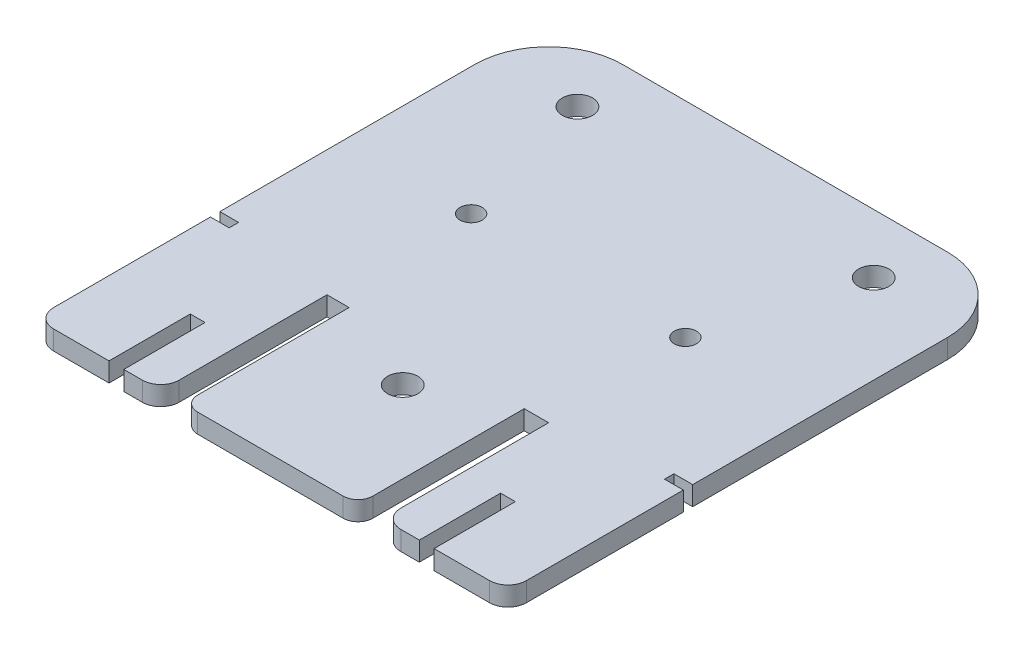
from build123d import *

# Parameters (mm, degrees)
MAIN_BODY_DEPTH          = 2.6
SCREW_HOLES_DEPTH        = 57.095989161
SCREW_HOLES_DEPTH_BACK   = 57.095989161
SKETCH2_R                = 2.05
SKETCH2_R_2              = 1.5
MAIN_LOWER_BODY_FILLET_R = 2
SKETCH5_W                = 17
SKETCH5_H                = 2.6
BOSS_EXTRUDE1_DEPTH      = 22.5
SKETCH6_W                = 2
SKETCH6_H                = 11
CUT_EXTRUDE1_DEPTH       = 22.5
FILLET2_R                = 2.5
SKETCH7_W                = 2.54
SKETCH7_H                = 1.27
CUT_EXTRUDE2_DEPTH       = 57.095989161


with BuildPart() as part:
    # Sketch1 → Main Body (new body)
    with BuildSketch(Plane(origin=(0, 0, 0), x_dir=(1, 0, 0), z_dir=(0, 1, 0))):
        with BuildLine():
            Line((11.7, -23.5), (32, -23.5))
            Line((32, -23.5), (32, 13.5))
            ThreePointArc((32, 13.5), (29.071067812, 20.571067812), (22, 23.5))
            Line((22, 23.5), (-22, 23.5))
            ThreePointArc((-22, 23.5), (-29.071067812, 20.571067812), (-32, 13.5))
            Line((-32, 13.5), (-32, -23.5))
            Line((-32, -23.5), (-12, -23.5))
            Line((-12, -23.5), (-12, -46))
            Line((-12, -46), (11.7, -46))
            Line((11.7, -46), (11.7, -23.5))
        make_face()
    extrude(amount=MAIN_BODY_DEPTH)

    # Sketch2 → Screw holes (cut, two sides: drawn at the far end of the back side and taken through both)
    with BuildSketch(Plane(origin=(0, 2.6, 0), x_dir=(1, 0, 0), z_dir=(0, 1, 0)).offset(-SCREW_HOLES_DEPTH_BACK)):
        with Locations((-20.1, 15.4999906)):
            Circle(SKETCH2_R)
        with Locations((20, 15.5)):
            Circle(SKETCH2_R)
        with Locations((-14.740009048, -4.250009446)):
            Circle(SKETCH2_R_2)
        with Locations((14.259990952, -4.250009446)):
            Circle(SKETCH2_R_2)
        with Locations((0.7, -28.9500094)):
            Circle(SKETCH2_R)
    extrude(amount=SCREW_HOLES_DEPTH + SCREW_HOLES_DEPTH_BACK, mode=Mode.SUBTRACT)

    # Main lower body Fillet
    main_lower_body_fillet_edges = [part.edges().sort_by_distance(p)[0] for p in [
        (11.7, 1.3, 46),
        (-12, 1.3, 46),
    ]]
    fillet(main_lower_body_fillet_edges, radius=MAIN_LOWER_BODY_FILLET_R)

    # Sketch5 → Boss-Extrude1 (add)
    with BuildSketch(Plane.XY.offset(23.5)):
        with Locations((-23.5, 1.3)):
            Rectangle(SKETCH5_W, SKETCH5_H)
        with Locations((23.5, 1.3)):
            Rectangle(SKETCH5_W, SKETCH5_H)
    extrude(amount=BOSS_EXTRUDE1_DEPTH)

    # Sketch6 → Cut-Extrude1 (cut)
    with BuildSketch(Plane(origin=(0, 2.6, 0), x_dir=(1, 0, 0), z_dir=(0, 1, 0))):
        with Locations((-21, -40.5)):
            Rectangle(SKETCH6_W, SKETCH6_H)
        with Locations((21, -40.5)):
            Rectangle(SKETCH6_W, SKETCH6_H)
    extrude(amount=-CUT_EXTRUDE1_DEPTH, mode=Mode.SUBTRACT)

    # Fillet2
    fillet2_edges = [part.edges().sort_by_distance(p)[0] for p in [
        (-32, 1.3, 46),
        (-15, 1.3, 46),
        (15, 1.3, 46),
        (32, 1.3, 46),
    ]]
    fillet(fillet2_edges, radius=FILLET2_R)

    # Sketch7 → Cut-Extrude2 (cut, through all)
    with BuildSketch(Plane(origin=(0, 2.6, 0), x_dir=(1, 0, 0), z_dir=(0, 1, 0))):
        with Locations((-30.73, -21.635)):
            Rectangle(SKETCH7_W, SKETCH7_H)
        with Locations((30.73, -21.635)):
            Rectangle(SKETCH7_W, SKETCH7_H)
    extrude(amount=-CUT_EXTRUDE2_DEPTH, mode=Mode.SUBTRACT)


solid = part.part
